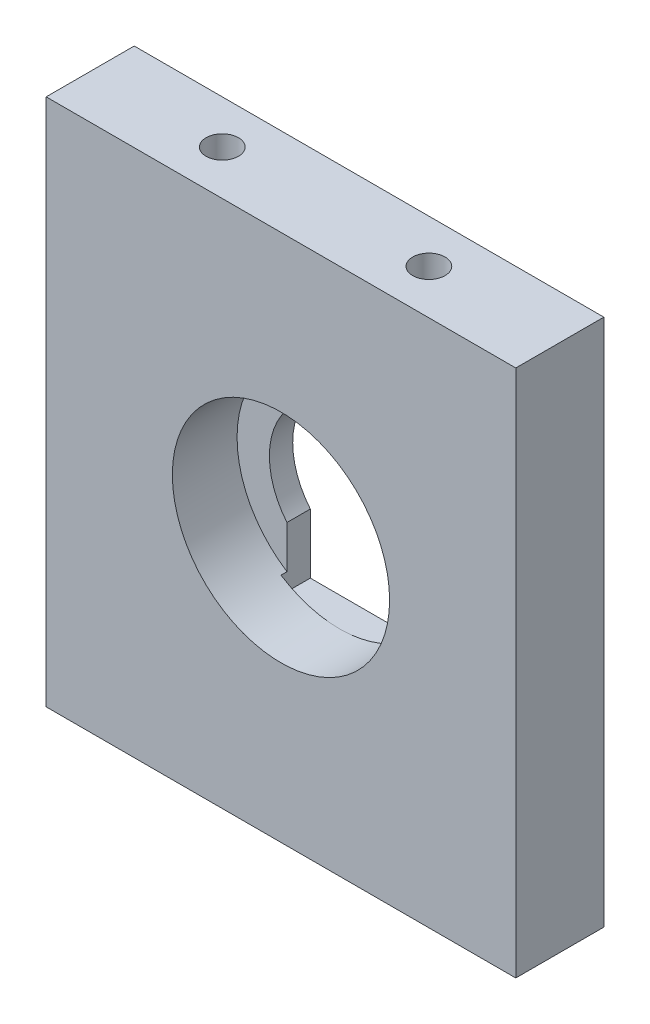
from build123d import *

# Parameters (mm, degrees)
SKETCH2_W                 = 114.3
SKETCH2_H                 = 101.6
BOSS_EXTRUDE2_DEPTH       = 19.05
M8X1_0_TAPPED_HOLE1_D     = 7
M8X1_0_TAPPED_HOLE1_DEPTH = 19.05
M8X1_0_TAPPED_HOLE1_TIP   = 2.103012167
M8X1_0_TAPPED_HOLE2_D     = 7
M8X1_0_TAPPED_HOLE2_DEPTH = 19.05
M8X1_0_TAPPED_HOLE2_TIP   = 2.103012167
SKETCH7_R                 = 23.5000038
CUT_EXTRUDE1_DEPTH        = 13.99999994
SKETCH8_W                 = 25.4
SKETCH8_H                 = 47.0000076
CUT_EXTRUDE3_DEPTH        = 6.35
SKETCH10_R                = 16.51
CUT_EXTRUDE4_DEPTH        = 155.110195964


with BuildPart() as part:
    # Sketch2 → Boss-Extrude2 (new body)
    with BuildSketch(Plane(origin=(0, 0, 0), x_dir=(0, 1, 0), z_dir=(0, 0, 1))):
        with Locations((57.15, 50.8)):
            Rectangle(SKETCH2_W, SKETCH2_H)
    extrude(amount=BOSS_EXTRUDE2_DEPTH)

    # M8x1.0 Tapped Hole1
    with Locations(Plane.XZ):
        with Locations((-28.448, 9.652), (-73.152, 9.652)):
            Hole(M8X1_0_TAPPED_HOLE1_D / 2, depth=M8X1_0_TAPPED_HOLE1_DEPTH)
            with Locations((0, 0, -(M8X1_0_TAPPED_HOLE1_DEPTH + M8X1_0_TAPPED_HOLE1_TIP / 2))):  # 118° drill point
                Cone(0, M8X1_0_TAPPED_HOLE1_D / 2, M8X1_0_TAPPED_HOLE1_TIP, mode=Mode.SUBTRACT)

    # M8x1.0 Tapped Hole2
    with Locations(Plane(origin=(0, 114.3, 0), x_dir=(-1, 0, 0), z_dir=(0, 1, 0))):
        with Locations((73.152, 9.398), (28.448, 9.398)):
            Hole(M8X1_0_TAPPED_HOLE2_D / 2, depth=M8X1_0_TAPPED_HOLE2_DEPTH)
            with Locations((0, 0, -(M8X1_0_TAPPED_HOLE2_DEPTH + M8X1_0_TAPPED_HOLE2_TIP / 2))):  # 118° drill point
                Cone(0, M8X1_0_TAPPED_HOLE2_D / 2, M8X1_0_TAPPED_HOLE2_TIP, mode=Mode.SUBTRACT)

    # Sketch7 → Cut-Extrude1 (cut)
    with BuildSketch(Plane.XY.offset(19.05)):
        with Locations((-50.8, 57.15)):
            Circle(SKETCH7_R)
    extrude(amount=-CUT_EXTRUDE1_DEPTH, mode=Mode.SUBTRACT)

    # Sketch8 → Cut-Extrude3 (cut)
    with BuildSketch(Plane(origin=(0, 0, 0), x_dir=(1, 0, 0), z_dir=(0, 0, -1))):
        with Locations((-50.8, -57.15)):
            Rectangle(SKETCH8_W, SKETCH8_H)
    extrude(amount=-CUT_EXTRUDE3_DEPTH, mode=Mode.SUBTRACT)

    # Sketch10 → Cut-Extrude4 (cut, through all)
    with BuildSketch(Plane(origin=(0, 0, 0), x_dir=(1, 0, 0), z_dir=(0, 0, -1))):
        with Locations((-50.8, -57.15)):
            Circle(SKETCH10_R)
    extrude(amount=-CUT_EXTRUDE4_DEPTH, mode=Mode.SUBTRACT)


solid = part.part
